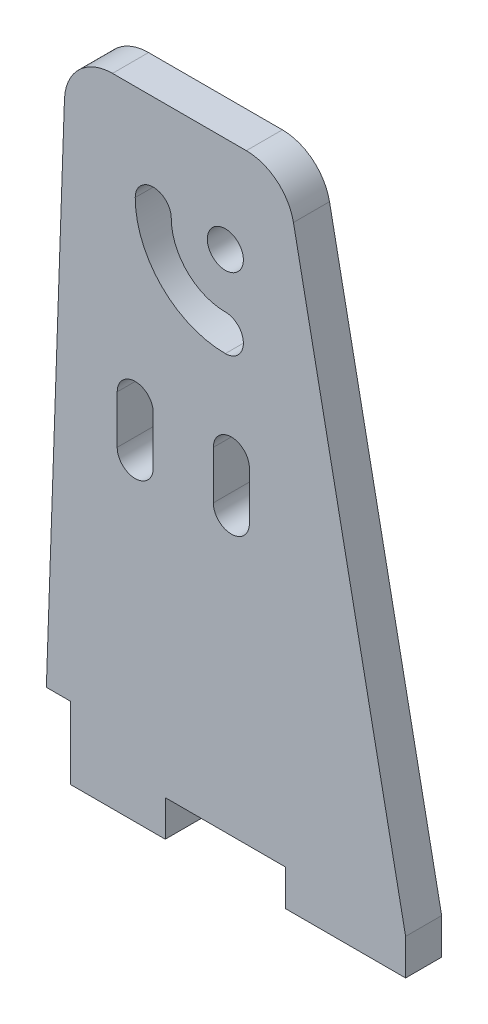
from build123d import *

# Parameters (mm, degrees)
SKETCH1_R           = 1.5
BOSS_EXTRUDE1_DEPTH = 3
CUT_EXTRUDE1_DEPTH  = 46.359061862


with BuildPart() as part:
    # Sketch1 → Boss-Extrude1 (new body)
    with BuildSketch(Plane.XY):
        with BuildLine():
            Line((-36.448598131, -26.168224299), (-36.448598131, -23.168224299))
            Line((-36.448598131, -23.168224299), (-34.837367865, 22.971373688))
            ThreePointArc((-34.837367865, 22.971373688), (-33.618438039, 25.709134902), (-30.839804557, 26.831775701))
            Line((-30.839804557, 26.831775701), (-19.702559656, 26.831775701))
            ThreePointArc((-19.702559656, 26.831775701), (-17.165801235, 25.924485955), (-15.779830266, 23.614204058))
            Line((-15.779830266, 23.614204058), (-6.448598131, -23.168224299))
            Line((-6.448598131, -23.168224299), (-6.448598131, -26.168224299))
            Line((-6.448598131, -26.168224299), (-16.448598131, -26.168224299))
            Line((-16.448598131, -26.168224299), (-16.448598131, -23.168224299))
            Line((-16.448598131, -23.168224299), (-26.448598131, -23.168224299))
            Line((-26.448598131, -23.168224299), (-26.448598131, -26.168224299))
            Line((-26.448598131, -26.168224299), (-36.448598131, -26.168224299))
        make_face()
        with Locations((-21.448598131, 18.831775701)):
            Circle(SKETCH1_R, mode=Mode.SUBTRACT)
        with BuildLine():
            Line((-27.448598131, 4.074261176), (-27.448598131, 0.074261176))
            ThreePointArc((-27.448598131, 0.074261176), (-28.948598131, -1.425738824), (-30.448598131, 0.074261176))
            Line((-30.448598131, 0.074261176), (-30.448598131, 4.074261176))
            ThreePointArc((-30.448598131, 4.074261176), (-28.948598131, 5.574261176), (-27.448598131, 4.074261176))
        make_face(mode=Mode.SUBTRACT)
        with BuildLine():
            Line((-19.448598131, 4.074261176), (-19.448598131, 0.074261176))
            ThreePointArc((-19.448598131, 0.074261176), (-20.948598131, -1.425738824), (-22.448598131, 0.074261176))
            Line((-22.448598131, 0.074261176), (-22.448598131, 4.074261176))
            ThreePointArc((-22.448598131, 4.074261176), (-20.948598131, 5.574261176), (-19.448598131, 4.074261176))
        make_face(mode=Mode.SUBTRACT)
        with BuildLine():
            ThreePointArc((-28.948598131, 18.831775701), (-26.75189899, 13.528474842), (-21.448598131, 11.331775701))
            ThreePointArc((-21.448598131, 11.331775701), (-19.948598131, 12.831775701), (-21.448598131, 14.331775701))
            ThreePointArc((-21.448598131, 14.331775701), (-24.630578646, 15.649795186), (-25.948598131, 18.831775701))
            ThreePointArc((-25.948598131, 18.831775701), (-27.448598131, 20.331775701), (-28.948598131, 18.831775701))
        make_face(mode=Mode.SUBTRACT)
    extrude(amount=BOSS_EXTRUDE1_DEPTH)

    # Sketch2 → Cut-Extrude1 (cut, through all)
    with BuildSketch(Plane.XY.offset(3)):
        Polygon((-34.343835822, -26.168224299), (-34.343835822, -20.168224299), (-36.343835822, -20.168224299), (-36.448598131, -23.168224299), (-36.448598131, -26.168224299), align=None)
    extrude(amount=-CUT_EXTRUDE1_DEPTH, mode=Mode.SUBTRACT)


solid = part.part
